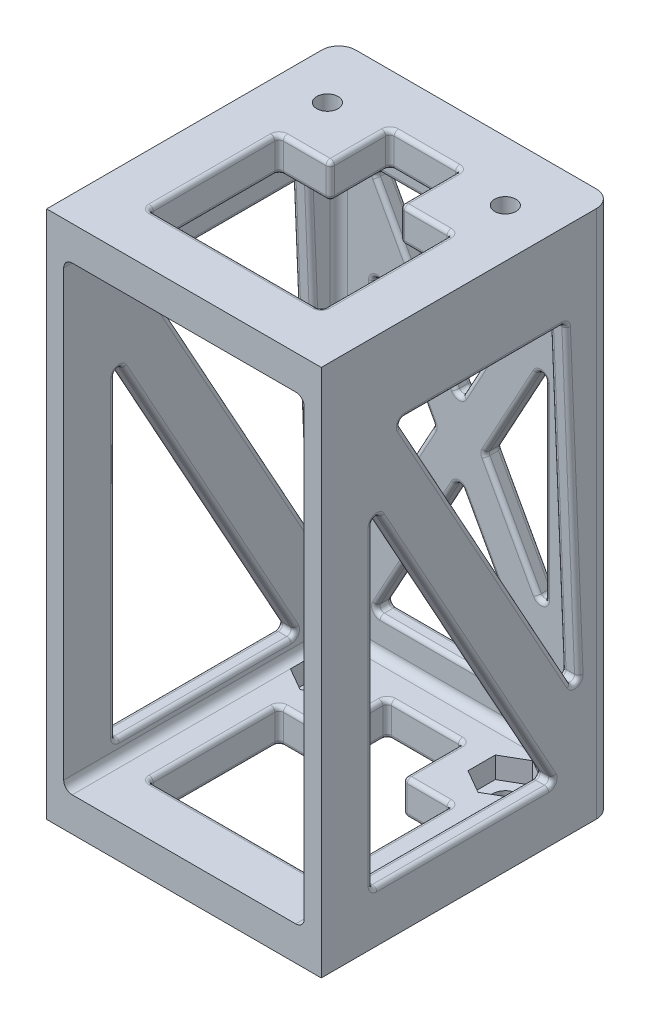
from build123d import *

# Parameters (mm, degrees)
SKETCH1_W           = 32.2
SKETCH1_H           = 34.25
BOSS_EXTRUDE1_DEPTH = 4
SKETCH5_W           = 32.2
SKETCH5_H           = 34.25
BOSS_EXTRUDE2_DEPTH = 4
SKETCH11_W          = 34.25
SKETCH11_H          = 54
BOSS_EXTRUDE3_DEPTH = 2
CUT_EXTRUDE1_REACH  = 79.807
LPATTERN1_COUNT     = 2
LPATTERN1_PITCH     = 30.2
CUT_EXTRUDE3_REACH  = 79.807
CUT_EXTRUDE4_REACH  = 79.807
BOSS_EXTRUDE5_REACH = 79.001
SKETCH18_W          = 2
SKETCH18_H          = 54
CUT_EXTRUDE5_REACH  = 79.807
FILLET9_R           = 0.5
FILLET10_R          = 1
FILLET11_R          = 2
SKETCH20_R          = 1.5
CUT_EXTRUDE6_DEPTH  = 10
CUT_EXTRUDE7_REACH  = 79.807
SKETCH21_R          = 1.25
CUT_EXTRUDE8_DEPTH  = 2.5


with BuildPart() as part:
    # Sketch1 → Boss-Extrude1 (new body)
    with BuildSketch(Plane(origin=(0, 0, 0), x_dir=(1, 0, 0), z_dir=(0, 1, 0))):
        with Locations((16.1, 17.125)):
            Rectangle(SKETCH1_W, SKETCH1_H)
    extrude(amount=BOSS_EXTRUDE1_DEPTH)



with BuildPart() as body_2:
    # Sketch5 → Boss-Extrude2 (new body)
    with BuildSketch(Plane(origin=(0, 58, 0), x_dir=(1, 0, 0), z_dir=(0, 1, 0))):
        with Locations((16.1, 17.125)):
            Rectangle(SKETCH5_W, SKETCH5_H)
    extrude(amount=BOSS_EXTRUDE2_DEPTH)


with BuildPart() as part_1:
    add(part.part)

    add(body_2.part)  # Boss-Extrude3 merges body 2
    # Sketch11 → Boss-Extrude3 (add)
    with BuildSketch(Plane.ZY):
        with Locations((-17.125, 31)):
            Rectangle(SKETCH11_W, SKETCH11_H)
    boss_extrude3 = extrude(amount=-BOSS_EXTRUDE3_DEPTH)

    # Sketch13 → Cut-Extrude1 (cut, up to next)
    with BuildSketch(Plane.ZY, mode=Mode.PRIVATE) as cut_extrude1_sk1:
        Polygon((-28.692392502, 52), (-8.951510909, 52), (-30.282121928, 13.386923119), align=None)
    cut_extrude1_tool1 = extrude(cut_extrude1_sk1.sketch, amount=-CUT_EXTRUDE1_REACH, mode=Mode.PRIVATE) & part_1.part
    # Sketch13 → Cut-Extrude1 (cut, up to next)
    with BuildSketch(Plane.ZY, mode=Mode.PRIVATE) as cut_extrude1_sk2:
        Polygon((-6, 44.934491201), (-6, 6), (-27.50816651, 6), align=None)
    cut_extrude1_tool2 = extrude(cut_extrude1_sk2.sketch, amount=-CUT_EXTRUDE1_REACH, mode=Mode.PRIVATE) & part_1.part
    cut_extrude1_1 = cut_extrude1_tool1.solids().sort_by_distance((0, 39.128974, -22.642008))[0]
    add(cut_extrude1_1, mode=Mode.SUBTRACT)
    cut_extrude1_2 = cut_extrude1_tool2.solids().sort_by_distance((0, 18.978164, -13.169389))[0]
    add(cut_extrude1_2, mode=Mode.SUBTRACT)
    cut_extrude1 = cut_extrude1_1 + cut_extrude1_2  # Cut-Extrude1 as one shape, for the pattern or mirror that repeats it

    # LPattern1: Boss-Extrude3, Cut-Extrude1 ×2
    with Locations(*[(i * LPATTERN1_PITCH, 0, 0) for i in range(1, LPATTERN1_COUNT)]):
        add(boss_extrude3)
        add(cut_extrude1, mode=Mode.SUBTRACT)

    # Sketch16 → Cut-Extrude3 (cut, up to next)
    with BuildSketch(Plane(origin=(0, 62, 0), x_dir=(1, 0, 0), z_dir=(0, 1, 0)), mode=Mode.PRIVATE) as cut_extrude3_sk1:
        Polygon((12, 21.25), (6, 21.25), (6, 6), (26.2, 6), (26.2, 21.25), (20.2, 21.25), (20.2, 28.25), (12, 28.25), align=None)
    cut_extrude3_tool1 = extrude(cut_extrude3_sk1.sketch, amount=-CUT_EXTRUDE3_REACH, mode=Mode.PRIVATE) & part_1.part
    add(cut_extrude3_tool1.solids().sort_by_distance((16.1, 62, -15.372366))[0], mode=Mode.SUBTRACT)

    # Sketch17 → Cut-Extrude4 (cut, up to next)
    with BuildSketch(Plane.XZ, mode=Mode.PRIVATE) as cut_extrude4_sk1:
        Polygon((11.67, -21.25), (6, -21.25), (6, -6), (26.2, -6), (26.2, -21.25), (20.53, -21.25), (20.53, -28.25), (11.67, -28.25), align=None)
    cut_extrude4_tool1 = extrude(cut_extrude4_sk1.sketch, amount=-CUT_EXTRUDE4_REACH, mode=Mode.PRIVATE) & part_1.part
    add(cut_extrude4_tool1.solids().sort_by_distance((16.1, 0, -15.489438))[0], mode=Mode.SUBTRACT)

    # Sketch18 → Boss-Extrude5 (add, up to next)
    with BuildSketch(Plane(origin=(2, 0, 0), x_dir=(0, 0, -1), z_dir=(1, 0, 0)), mode=Mode.PRIVATE) as boss_extrude5_sk1:
        with Locations((33.25, 31)):
            Rectangle(SKETCH18_W, SKETCH18_H)
    boss_extrude5_tool1 = extrude(boss_extrude5_sk1.sketch, amount=BOSS_EXTRUDE5_REACH, mode=Mode.PRIVATE) - part_1.part
    add(boss_extrude5_tool1.solids().sort_by_distance((2, 31, -33.25))[0])

    # Sketch19 → Cut-Extrude5 (cut, up to next)
    with BuildSketch(Plane(origin=(0, 0, -34.25), x_dir=(-1, 0, 0), z_dir=(0, 0, -1)), mode=Mode.PRIVATE) as cut_extrude5_sk1:
        Polygon((-26.2, 52.86920085), (-6, 52.86920085), (-16.1, 34.434600425), align=None)
    cut_extrude5_tool1 = extrude(cut_extrude5_sk1.sketch, amount=-CUT_EXTRUDE5_REACH, mode=Mode.PRIVATE) & part_1.part
    # Sketch19 → Cut-Extrude5 (cut, up to next)
    with BuildSketch(Plane(origin=(0, 0, -34.25), x_dir=(-1, 0, 0), z_dir=(0, 0, -1)), mode=Mode.PRIVATE) as cut_extrude5_sk2:
        Polygon((-16.1, 26.434600425), (-26.2, 8), (-6, 8), align=None)
    cut_extrude5_tool2 = extrude(cut_extrude5_sk2.sketch, amount=-CUT_EXTRUDE5_REACH, mode=Mode.PRIVATE) & part_1.part
    # Sketch19 → Cut-Extrude5 (cut, up to next)
    with BuildSketch(Plane(origin=(0, 0, -34.25), x_dir=(-1, 0, 0), z_dir=(0, 0, -1)), mode=Mode.PRIVATE) as cut_extrude5_sk3:
        Polygon((-6, 43.398410284), (-6, 17.470790567), (-13.102648094, 30.434600425), align=None)
    cut_extrude5_tool3 = extrude(cut_extrude5_sk3.sketch, amount=-CUT_EXTRUDE5_REACH, mode=Mode.PRIVATE) & part_1.part
    # Sketch19 → Cut-Extrude5 (cut, up to next)
    with BuildSketch(Plane(origin=(0, 0, -34.25), x_dir=(-1, 0, 0), z_dir=(0, 0, -1)), mode=Mode.PRIVATE) as cut_extrude5_sk4:
        Polygon((-26.2, 43.398410284), (-19.097351906, 30.434600425), (-26.2, 17.470790567), align=None)
    cut_extrude5_tool4 = extrude(cut_extrude5_sk4.sketch, amount=-CUT_EXTRUDE5_REACH, mode=Mode.PRIVATE) & part_1.part
    add(cut_extrude5_tool1.solids().sort_by_distance((16.1, 46.724334, -34.25))[0], mode=Mode.SUBTRACT)
    add(cut_extrude5_tool2.solids().sort_by_distance((16.1, 14.144867, -34.25))[0], mode=Mode.SUBTRACT)
    add(cut_extrude5_tool3.solids().sort_by_distance((8.367549, 30.4346, -34.25))[0], mode=Mode.SUBTRACT)
    add(cut_extrude5_tool4.solids().sort_by_distance((23.832451, 30.4346, -34.25))[0], mode=Mode.SUBTRACT)

    # Fillet9
    fillet9_edges = [part_1.edges().sort_by_distance(p)[0] for p in [
        (26.2, 62, -13.625),
        (26.2, 58, -13.625),
        (6, 58, -13.625),
        (6, 62, -13.625),
        (12, 58, -24.75),
        (12, 62, -24.75),
        (20.2, 62, -24.75),
        (20.2, 58, -24.75),
        (26.2, 4, -13.625),
        (26.2, 0, -13.625),
        (16.1, 4, -28.25),
        (16.1, 0, -28.25),
        (6, 0, -13.625),
        (6, 4, -13.625),
        (2, 6, -16.754083255),
        (0, 6, -16.754083255),
        (0, 25.4672456, -6),
        (2, 25.4672456, -6),
        (2, 52, -18.821951706),
        (0, 52, -18.821951706),
        (0, 32.693461559, -29.487257215),
        (2, 32.693461559, -29.487257215),
        (32.2, 6, -16.754083255),
        (30.2, 6, -16.754083255),
        (30.2, 25.4672456, -6),
        (32.2, 25.4672456, -6),
        (32.2, 52, -18.821951706),
        (30.2, 52, -18.821951706),
        (30.2, 32.693461559, -29.487257215),
        (32.2, 32.693461559, -29.487257215),
        (22.648675953, 23.952695496, -32.25),
        (22.648675953, 23.952695496, -34.25),
        (22.648675953, 36.916505354, -34.25),
        (22.648675953, 36.916505354, -32.25),
        (9.551324047, 36.916505354, -32.25),
        (9.551324047, 36.916505354, -34.25),
        (9.551324047, 23.952695496, -34.25),
        (9.551324047, 23.952695496, -32.25),
        (21.15, 43.651900638, -32.25),
        (21.15, 43.651900638, -34.25),
        (11.05, 43.651900638, -34.25),
        (11.05, 43.651900638, -32.25),
        (11.05, 17.217300213, -32.25),
        (11.05, 17.217300213, -34.25),
        (21.15, 17.217300213, -34.25),
        (21.15, 17.217300213, -32.25),
        (26.2, 60, -6),
        (16.1, 62, -6),
        (6, 60, -6),
        (16.1, 58, -6),
        (20.2, 60, -21.25),
        (23.2, 62, -21.25),
        (26.2, 60, -21.25),
        (23.2, 58, -21.25),
        (6, 60, -21.25),
        (9, 62, -21.25),
        (12, 60, -21.25),
        (9, 58, -21.25),
        (12, 60, -28.25),
        (16.1, 62, -28.25),
        (20.2, 60, -28.25),
        (16.1, 58, -28.25),
        (6, 2, -6),
        (16.1, 0, -6),
        (26.2, 2, -6),
        (16.1, 4, -6),
        (26.2, 2, -21.25),
        (23.365, 0, -21.25),
        (23.365, 4, -21.25),
        (20.53, 2, -21.25),
        (20.53, 0, -24.75),
        (20.53, 2, -28.25),
        (20.53, 4, -24.75),
        (11.67, 2, -28.25),
        (11.67, 0, -24.75),
        (11.67, 4, -24.75),
        (11.67, 2, -21.25),
        (8.835, 0, -21.25),
        (6, 2, -21.25),
        (8.835, 4, -21.25),
        (1, 6, -27.50816651),
        (0, 25.4672456, -16.754083255),
        (1, 44.934491201, -6),
        (2, 25.4672456, -16.754083255),
        (1, 52, -8.951510909),
        (0, 32.693461559, -19.616816419),
        (1, 13.386923119, -30.282121928),
        (2, 32.693461559, -19.616816419),
        (31.2, 6, -27.50816651),
        (30.2, 25.4672456, -16.754083255),
        (31.2, 44.934491201, -6),
        (32.2, 25.4672456, -16.754083255),
        (31.2, 52, -8.951510909),
        (30.2, 32.693461559, -19.616816419),
        (31.2, 13.386923119, -30.282121928),
        (32.2, 32.693461559, -19.616816419),
        (26.2, 17.470790567, -33.25),
        (26.2, 30.434600425, -34.25),
        (26.2, 43.398410284, -33.25),
        (26.2, 30.434600425, -32.25),
        (6, 43.398410284, -33.25),
        (6, 30.434600425, -34.25),
        (6, 17.470790567, -33.25),
        (6, 30.434600425, -32.25),
        (26.2, 52.86920085, -33.25),
        (16.1, 52.86920085, -34.25),
        (6, 52.86920085, -33.25),
        (16.1, 52.86920085, -32.25),
        (6, 8, -33.25),
        (16.1, 8, -34.25),
        (26.2, 8, -33.25),
        (16.1, 8, -32.25),
        (1, 6, -6),
        (1, 52, -28.692392502),
        (31.2, 6, -6),
        (31.2, 52, -28.692392502),
        (19.097351906, 30.434600425, -33.25),
        (13.102648094, 30.434600425, -33.25),
        (16.1, 26.434600425, -33.25),
        (16.1, 34.434600425, -33.25),
    ]]
    fillet(fillet9_edges, radius=FILLET9_R)

    # Fillet10
    fillet10_edges = [part_1.edges().sort_by_distance(p)[0] for p in [
        (30.2, 58, -16.125),
        (2, 58, -16.125),
        (16.1, 58, -32.25),
        (30.2, 4, -16.125),
        (30.2, 31, -32.25),
        (2, 31, -32.25),
        (2, 4, -16.125),
        (16.1, 4, -32.25),
    ]]
    fillet(fillet10_edges, radius=FILLET10_R)

    # Fillet11
    fillet11_edges = [part_1.edges().sort_by_distance(p)[0] for p in [
        (32.2, 31, -34.25),
        (0, 31, -34.25),
    ]]
    fillet(fillet11_edges, radius=FILLET11_R)

    # Sketch20 → Cut-Extrude6 (cut)
    with BuildSketch(Plane(origin=(0, 4, 0), x_dir=(1, 0, 0), z_dir=(0, 1, 0))):
        with Locations((5.67, 27.25)):
            Circle(SKETCH20_R)
        with Locations((26.53, 27.25)):
            Circle(SKETCH20_R)
    extrude(amount=-CUT_EXTRUDE6_DEPTH, mode=Mode.SUBTRACT)

    # Sketch21 → Cut-Extrude7 (cut, up to next)
    with BuildSketch(Plane(origin=(0, 62, 0), x_dir=(1, 0, 0), z_dir=(0, 1, 0)), mode=Mode.PRIVATE) as cut_extrude7_sk1:
        with Locations((5.67, 27.25)):
            Circle(SKETCH21_R)
    cut_extrude7_tool1 = extrude(cut_extrude7_sk1.sketch, amount=-CUT_EXTRUDE7_REACH, mode=Mode.PRIVATE) & part_1.part
    # Sketch21 → Cut-Extrude7 (cut, up to next)
    with BuildSketch(Plane(origin=(0, 62, 0), x_dir=(1, 0, 0), z_dir=(0, 1, 0)), mode=Mode.PRIVATE) as cut_extrude7_sk2:
        with Locations((26.53, 27.25)):
            Circle(SKETCH21_R)
    cut_extrude7_tool2 = extrude(cut_extrude7_sk2.sketch, amount=-CUT_EXTRUDE7_REACH, mode=Mode.PRIVATE) & part_1.part
    add(cut_extrude7_tool1.solids().sort_by_distance((5.67, 62, -27.25))[0], mode=Mode.SUBTRACT)
    add(cut_extrude7_tool2.solids().sort_by_distance((26.53, 62, -27.25))[0], mode=Mode.SUBTRACT)

    # Sketch22 → Cut-Extrude8 (cut)
    with BuildSketch(Plane(origin=(0, 4, 0), x_dir=(1, 0, 0), z_dir=(0, 1, 0))):
        Polygon((8.445, 25.647853003), (8.445, 28.852146997), (5.67, 30.454293994), (2.895, 28.852146997), (2.895, 25.647853003), (5.67, 24.045706006), align=None)
        Polygon((23.755, 25.647853003), (26.53, 24.045706006), (29.305, 25.647853003), (29.305, 28.852146997), (26.53, 30.454293994), (23.755, 28.852146997), align=None)
    extrude(amount=-CUT_EXTRUDE8_DEPTH, mode=Mode.SUBTRACT)


solid = part_1.part
